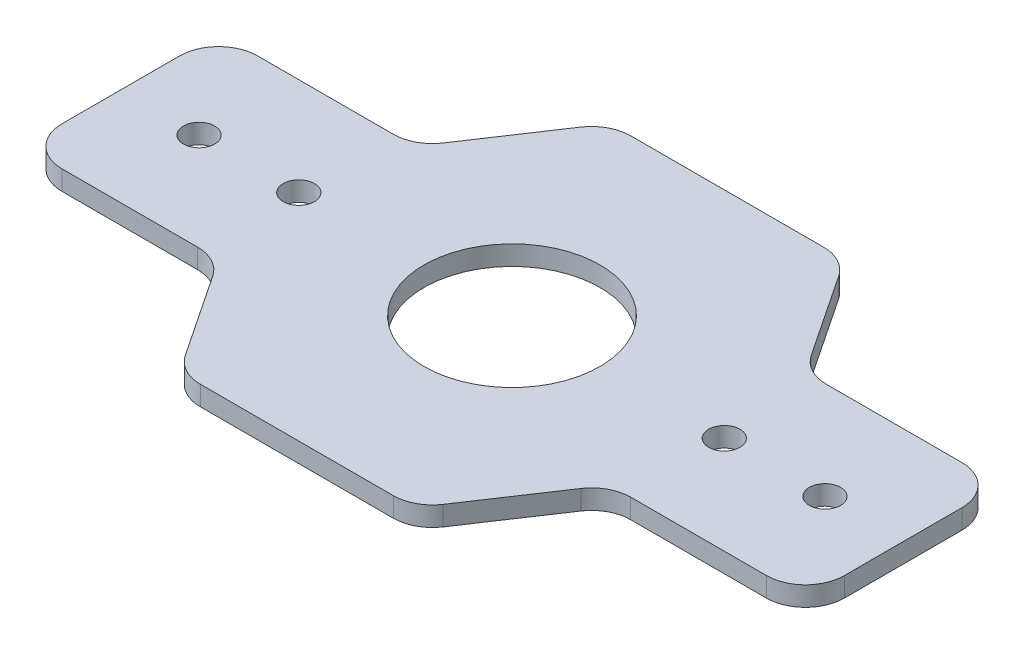
from build123d import *

# Parameters (mm, degrees)
SKETCH1_R           = 2.54
BOSS_EXTRUDE1_DEPTH = 3.175
FILLET1_R           = 6.35
SKETCH2_R           = 14.2875
CUT_EXTRUDE1_DEPTH  = 3.175
SKETCH3_R           = 2.54
CUT_EXTRUDE2_DEPTH  = 120.558881937


with BuildPart() as part:
    # Sketch1 → Boss-Extrude1 (new body)
    with BuildSketch(Plane(origin=(0, 0, 0), x_dir=(1, 0, 0), z_dir=(0, 1, 0))):
        Polygon((19.05, 15.875), (31.75, 34.925), (69.85, 34.925), (82.55, 15.875), (114.3, 15.875), (114.3, -15.875), (82.55, -15.875), (69.85, -34.925), (31.75, -34.925), (19.05, -15.875), (-12.7, -15.875), (-12.7, 15.875), align=None)
        Circle(SKETCH1_R, mode=Mode.SUBTRACT)
        with Locations((101.6, 0)):
            Circle(SKETCH1_R, mode=Mode.SUBTRACT)
    extrude(amount=BOSS_EXTRUDE1_DEPTH)

    # Fillet1
    fillet1_edges = [part.edges().sort_by_distance(p)[0] for p in [
        (19.05, 1.5875, -15.875),
        (31.75, 1.5875, -34.925),
        (69.85, 1.5875, -34.925),
        (82.55, 1.5875, -15.875),
        (114.3, 1.5875, -15.875),
        (114.3, 1.5875, 15.875),
        (82.55, 1.5875, 15.875),
        (69.85, 1.5875, 34.925),
        (31.75, 1.5875, 34.925),
        (19.05, 1.5875, 15.875),
        (-12.7, 1.5875, -15.875),
        (-12.7, 1.5875, 15.875),
    ]]
    fillet(fillet1_edges, radius=FILLET1_R)

    # Sketch2 → Cut-Extrude1 (cut)
    with BuildSketch(Plane(origin=(0, 3.175, 0), x_dir=(1, 0, 0), z_dir=(0, 1, 0))):
        with Locations((50.8, 0)):
            Circle(SKETCH2_R)
    extrude(amount=-CUT_EXTRUDE1_DEPTH, mode=Mode.SUBTRACT)

    # Sketch3 → Cut-Extrude2 (cut, through all)
    with BuildSketch(Plane(origin=(0, 3.175, 0), x_dir=(1, 0, 0), z_dir=(0, 1, 0))):
        with Locations((85.255689026, 0)):
            Circle(SKETCH3_R)
        with Locations((16.192906864, 0)):
            Circle(SKETCH3_R)
    extrude(amount=-CUT_EXTRUDE2_DEPTH, mode=Mode.SUBTRACT)


solid = part.part
